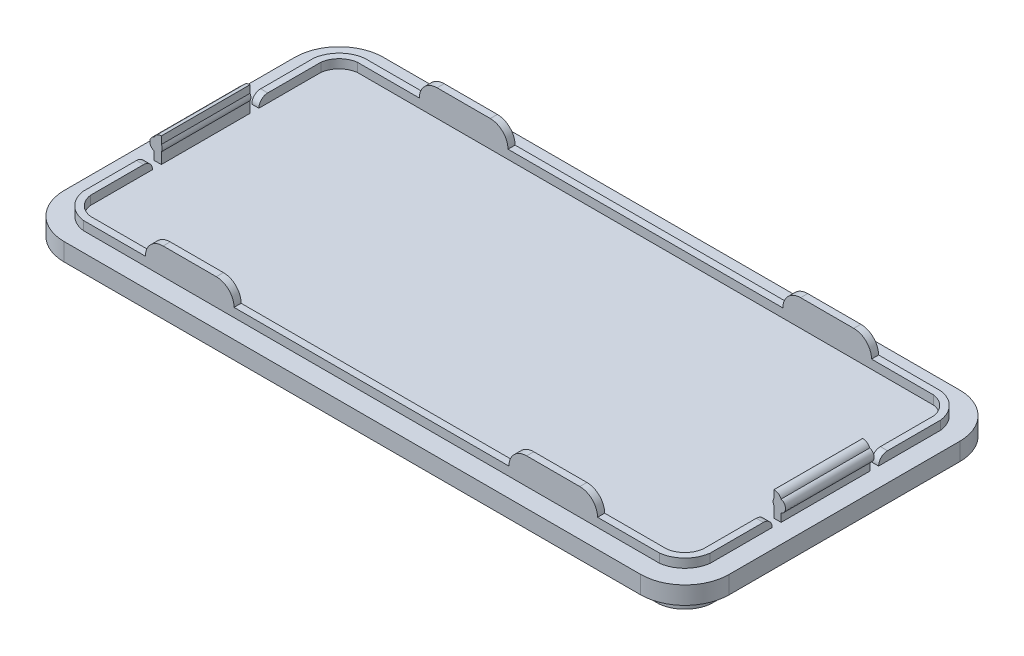
from build123d import *

# Parameters (mm, degrees)
EXTRUDE_2_DEPTH     = 2
EXTRUDE_4_DEPTH     = 1
SKETCH_7_W          = 0.8
SKETCH_7_H          = 10
EXTRUDE_8_DEPTH     = 2.8
SKETCH_8_R          = 0.7
EXTRUDE_9_DEPTH     = 10
FILLET_1_R          = 0.85
SKETCH_11_W         = 1
SKETCH_11_H         = 1
CUT_EXTRUDE_1_DEPTH = 1.2
FILLET_2_R          = 1
SKETCH_13_W         = 0.8
SKETCH_13_H         = 10
EXTRUDE_10_DEPTH    = 1.8
SKETCH_14_R         = 0.7
EXTRUDE_11_DEPTH    = 10
FILLET_3_R          = 0.85
SKETCH_15_W         = 0.8
SKETCH_15_H         = 1
CUT_EXTRUDE_3_DEPTH = 1
FILLET_4_R          = 1
EXTRUDE_START       = -2
EXTRUDE_12_DEPTH    = 2
SKETCH_18_R         = 3.225
SKETCH_18_R_2       = 2.225
EXTRUDE_13_DEPTH    = 2
CUT_EXTRUDE_4_DEPTH = 2
EXTRUDE_START_2     = 2
EXTRUDE_14_DEPTH    = 2
SKETCH_22_W         = 10
SKETCH_22_H         = 0.8
EXTRUDE_16_DEPTH    = 2
FILLET_5_R          = 2


# Some blends are built 0.0001 mm under size
with BuildPart() as part:
    # case 2 → 凸台-拉伸2 (new body)
    with BuildSketch(Plane(origin=(0, 0, 0), x_dir=(1, 0, 0), z_dir=(0, 1, 0))):
        with BuildLine():
            Line((-34.042196447, 18), (30.957803553, 18))
            ThreePointArc((30.957803553, 18), (34.493337459, 16.535533906), (35.957803553, 13))
            Line((35.957803553, 13), (35.957803553, -13))
            ThreePointArc((35.957803553, -13), (34.493337459, -16.535533906), (30.957803553, -18))
            Line((30.957803553, -18), (-34.042196447, -18))
            ThreePointArc((-34.042196447, -18), (-37.577730353, -16.535533906), (-39.042196447, -13))
            Line((-39.042196447, -13), (-39.042196447, 13))
            ThreePointArc((-39.042196447, 13), (-37.577730353, 16.535533906), (-34.042196447, 18))
        make_face()
    extrude(amount=EXTRUDE_2_DEPTH)

    # 草图3 → 凸台-拉伸4 (add)
    with BuildSketch(Plane(origin=(0, 2, 0), x_dir=(1, 0, 0), z_dir=(0, 1, 0))):
        with BuildLine():
            Line((-36.892196447, 13), (-36.892196447, -13))
            ThreePointArc((-36.892196447, -13), (-35.952846076, -14.910649629), (-34.042196447, -15.85))
            Line((-34.042196447, -15.85), (30.957803553, -15.85))
            ThreePointArc((30.957803553, -15.85), (32.868453181, -14.910649629), (33.807803553, -13))
            Line((33.807803553, -13), (33.807803553, 13))
            ThreePointArc((33.807803553, 13), (32.868453181, 14.910649629), (30.957803553, 15.85))
            Line((30.957803553, 15.85), (-34.042196447, 15.85))
            ThreePointArc((-34.042196447, 15.85), (-35.952846076, 14.910649629), (-36.892196447, 13))
        make_face()
        with BuildLine():
            Line((-34.042196447, -15.05), (30.957803553, -15.05))
            ThreePointArc((30.957803553, -15.05), (32.327315928, -14.369512375), (33.007803553, -13))
            Line((33.007803553, -13), (33.007803553, 13))
            ThreePointArc((33.007803553, 13), (32.327315928, 14.369512375), (30.957803553, 15.05))
            Line((30.957803553, 15.05), (-34.042196447, 15.05))
            ThreePointArc((-34.042196447, 15.05), (-35.411708823, 14.369512375), (-36.092196447, 13))
            Line((-36.092196447, 13), (-36.092196447, -13))
            ThreePointArc((-36.092196447, -13), (-35.411708823, -14.369512375), (-34.042196447, -15.05))
        make_face(mode=Mode.SUBTRACT)
    extrude(amount=EXTRUDE_4_DEPTH)

    # 草图7 → 凸台-拉伸8 (add)
    with BuildSketch(Plane(origin=(0, 2, 0), x_dir=(1, 0, 0), z_dir=(0, 1, 0))):
        with Locations((-36.492196447, 0)):
            Rectangle(SKETCH_7_W, SKETCH_7_H)
    extrude(amount=EXTRUDE_8_DEPTH)

    # 草图8 → 凸台-拉伸9 (add)
    with BuildSketch(Plane.XY.offset(5)):
        with Locations((-36.692196447, 3.6)):
            Circle(SKETCH_8_R)
    extrude(amount=-EXTRUDE_9_DEPTH)

    # 圆角1
    # the kernel refuses this fillet: 0.85 mm, written as the material it takes off along each edge
    with BuildSketch(Plane(origin=(-36.892196447, 4.8, 6.967826014), x_dir=(0, -1, 0), z_dir=(0, 0, -1))) as fillet_1_piece_1:
        with BuildLine():
            CenterArc((0.85, -0.787130406), FILLET_1_R, 112.174937704, 67.825062296)
            Line((0, -0.787130406), (-0.017, -0.787130406))
            Line((-0.017, -0.787130406), (-0.017, 0))
            Line((-0.017, 0), (0, 0.017))
            ThreePointArc((0, 0.017), (0.264589803, 0.017), (0.522763199, 0.015742608))
            Line((0.522763199, 0.015742608), (0.529179607, 0))
        make_face()
    extrude(amount=13.935652028, mode=Mode.SUBTRACT)

    # 草图11 → 切除-拉伸1 (cut)
    with BuildSketch(Plane.ZY.offset(36.892196447)):
        with Locations((5.5, 2.5)):
            Rectangle(SKETCH_11_W, SKETCH_11_H)
        with Locations((-5.5, 2.5)):
            Rectangle(SKETCH_11_W, SKETCH_11_H)
    extrude(amount=-CUT_EXTRUDE_1_DEPTH, mode=Mode.SUBTRACT)

    # 圆角2
    fillet_2_edges = [part.edges().sort_by_distance(p)[0] for p in [
        (-36.492196447, 3, 6),
        (-36.492196447, 3, -6),
    ]]
    fillet(fillet_2_edges, radius=FILLET_2_R - 0.0001)  # a hair under: the kernel refuses the full size

    # 草图13 → 凸台-拉伸10 (add)
    with BuildSketch(Plane(origin=(0, 3, 0), x_dir=(1, 0, 0), z_dir=(0, 1, 0))):
        with Locations((33.407803553, 0)):
            Rectangle(SKETCH_13_W, SKETCH_13_H)
    extrude(amount=EXTRUDE_10_DEPTH)

    # 草图14 → 凸台-拉伸11 (add)
    with BuildSketch(Plane.XY.offset(5)):
        with Locations((33.607803553, 3.6)):
            Circle(SKETCH_14_R)
    extrude(amount=-EXTRUDE_11_DEPTH)

    # 圆角3
    # the kernel refuses this fillet: 0.85 mm, written as the material it takes off along each edge
    with BuildSketch(Plane(origin=(33.807803553, 4.8, -6.967826014), x_dir=(0, -1, 0), z_dir=(0, 0, 1))) as fillet_3_piece_1:
        with BuildLine():
            CenterArc((0.85, -0.787130406), FILLET_3_R, 112.174937704, 67.825062296)
            Line((0, -0.787130406), (-0.017, -0.787130406))
            Line((-0.017, -0.787130406), (-0.017, 0))
            Line((-0.017, 0), (0, 0.017))
            ThreePointArc((0, 0.017), (0.264589803, 0.017), (0.522763199, 0.015742608))
            Line((0.522763199, 0.015742608), (0.529179607, 0))
        make_face()
    extrude(amount=13.935652028, mode=Mode.SUBTRACT)

    # 草图15 → 切除-拉伸3 (cut)
    with BuildSketch(Plane(origin=(0, 3, 0), x_dir=(1, 0, 0), z_dir=(0, 1, 0))):
        with Locations((33.407803553, 5.5)):
            Rectangle(SKETCH_15_W, SKETCH_15_H)
        with Locations((33.407803553, -5.5)):
            Rectangle(SKETCH_15_W, SKETCH_15_H)
    extrude(amount=-CUT_EXTRUDE_3_DEPTH, mode=Mode.SUBTRACT)

    # 圆角4
    fillet_4_edges = [part.edges().sort_by_distance(p)[0] for p in [
        (33.407803553, 3, 6),
        (33.407803553, 3, -6),
    ]]
    fillet(fillet_4_edges, radius=FILLET_4_R - 0.0001)  # a hair under: the kernel refuses the full size

    # 草图2 → 凸台-拉伸12 (add)
    with BuildSketch(Plane(origin=(0, 0, 0), x_dir=(1, 0, 0), z_dir=(0, 1, 0)).offset(EXTRUDE_START)):
        with BuildLine():
            Line((33.807803553, -13), (33.807803553, 13))
            ThreePointArc((33.807803553, 13), (32.868453181, 14.910649629), (30.957803553, 15.85))
            Line((30.957803553, 15.85), (-34.042196447, 15.85))
            ThreePointArc((-34.042196447, 15.85), (-35.952846076, 14.910649629), (-36.892196447, 13))
            Line((-36.892196447, 13), (-36.892196447, -13))
            ThreePointArc((-36.892196447, -13), (-35.952846076, -14.910649629), (-34.042196447, -15.85))
            Line((-34.042196447, -15.85), (30.957803553, -15.85))
            ThreePointArc((30.957803553, -15.85), (32.868453181, -14.910649629), (33.807803553, -13))
        make_face()
        with BuildLine():
            Line((-34.042196447, -15.05), (30.957803553, -15.05))
            ThreePointArc((30.957803553, -15.05), (32.327315928, -14.369512375), (33.007803553, -13))
            Line((33.007803553, -13), (33.007803553, 13))
            ThreePointArc((33.007803553, 13), (32.327315928, 14.369512375), (30.957803553, 15.05))
            Line((30.957803553, 15.05), (-34.042196447, 15.05))
            ThreePointArc((-34.042196447, 15.05), (-35.411708823, 14.369512375), (-36.092196447, 13))
            Line((-36.092196447, 13), (-36.092196447, -13))
            ThreePointArc((-36.092196447, -13), (-35.411708823, -14.369512375), (-34.042196447, -15.05))
        make_face(mode=Mode.SUBTRACT)
    extrude(amount=EXTRUDE_12_DEPTH)

    # 草图18 → 凸台-拉伸13 (add)
    # profile 1 of 50: a face of its own
    with BuildSketch(Plane.XZ):
        with Locations((-37.317196447, 15.9)):
            Circle(SKETCH_18_R)
        with Locations((-37.317196447, 15.9)):
            Circle(SKETCH_18_R_2, mode=Mode.SUBTRACT)
    # profile 2 of 50: a face of its own
    with BuildSketch(Plane.XZ):
        with Locations((-29.367196447, 15.9)):
            Circle(SKETCH_18_R)
        with Locations((-29.367196447, 15.9)):
            Circle(SKETCH_18_R_2, mode=Mode.SUBTRACT)
    # profile 3 of 50: a face of its own
    with BuildSketch(Plane.XZ):
        with Locations((-21.417196447, 15.9)):
            Circle(SKETCH_18_R)
        with Locations((-21.417196447, 15.9)):
            Circle(SKETCH_18_R_2, mode=Mode.SUBTRACT)
    # profile 4 of 50: a face of its own
    with BuildSketch(Plane.XZ):
        with Locations((-13.467196447, 15.9)):
            Circle(SKETCH_18_R)
        with Locations((-13.467196447, 15.9)):
            Circle(SKETCH_18_R_2, mode=Mode.SUBTRACT)
    # profile 5 of 50: a face of its own
    with BuildSketch(Plane.XZ):
        with Locations((-5.517196447, 15.9)):
            Circle(SKETCH_18_R)
        with Locations((-5.517196447, 15.9)):
            Circle(SKETCH_18_R_2, mode=Mode.SUBTRACT)
    # profile 6 of 50: a face of its own
    with BuildSketch(Plane.XZ):
        with Locations((2.432803553, 15.9)):
            Circle(SKETCH_18_R)
        with Locations((2.432803553, 15.9)):
            Circle(SKETCH_18_R_2, mode=Mode.SUBTRACT)
    # profile 7 of 50: a face of its own
    with BuildSketch(Plane.XZ):
        with Locations((10.382803553, 15.9)):
            Circle(SKETCH_18_R)
        with Locations((10.382803553, 15.9)):
            Circle(SKETCH_18_R_2, mode=Mode.SUBTRACT)
    # profile 8 of 50: a face of its own
    with BuildSketch(Plane.XZ):
        with Locations((18.332803553, 15.9)):
            Circle(SKETCH_18_R)
        with Locations((18.332803553, 15.9)):
            Circle(SKETCH_18_R_2, mode=Mode.SUBTRACT)
    # profile 9 of 50: a face of its own
    with BuildSketch(Plane.XZ):
        with Locations((26.282803553, 15.9)):
            Circle(SKETCH_18_R)
        with Locations((26.282803553, 15.9)):
            Circle(SKETCH_18_R_2, mode=Mode.SUBTRACT)
    # profile 10 of 50: a face of its own
    with BuildSketch(Plane.XZ):
        with Locations((34.232803553, 15.9)):
            Circle(SKETCH_18_R)
        with Locations((34.232803553, 15.9)):
            Circle(SKETCH_18_R_2, mode=Mode.SUBTRACT)
    # profile 11 of 50: a face of its own
    with BuildSketch(Plane.XZ):
        with Locations(Location((-29.367196447, 7.95, 0), (0, 0, 90))):
            Circle(SKETCH_18_R)
        with Locations(Location((-29.367196447, 7.95, 0), (0, 0, 270))):
            Circle(SKETCH_18_R_2, mode=Mode.SUBTRACT)
    # profile 12 of 50: a face of its own
    with BuildSketch(Plane.XZ):
        with Locations(Location((-21.417196447, 7.95, 0), (0, 0, 90))):
            Circle(SKETCH_18_R)
        with Locations(Location((-21.417196447, 7.95, 0), (0, 0, 270))):
            Circle(SKETCH_18_R_2, mode=Mode.SUBTRACT)
    # profile 13 of 50: a face of its own
    with BuildSketch(Plane.XZ):
        with Locations(Location((-13.467196447, 7.95, 0), (0, 0, 90))):
            Circle(SKETCH_18_R)
        with Locations(Location((-13.467196447, 7.95, 0), (0, 0, 270))):
            Circle(SKETCH_18_R_2, mode=Mode.SUBTRACT)
    # profile 14 of 50: a face of its own
    with BuildSketch(Plane.XZ):
        with Locations(Location((-5.517196447, 7.95, 0), (0, 0, 90))):
            Circle(SKETCH_18_R)
        with Locations(Location((-5.517196447, 7.95, 0), (0, 0, 270))):
            Circle(SKETCH_18_R_2, mode=Mode.SUBTRACT)
    # profile 15 of 50: a face of its own
    with BuildSketch(Plane.XZ):
        with Locations(Location((2.432803553, 7.95, 0), (0, 0, 90))):
            Circle(SKETCH_18_R)
        with Locations(Location((2.432803553, 7.95, 0), (0, 0, 270))):
            Circle(SKETCH_18_R_2, mode=Mode.SUBTRACT)
    # profile 16 of 50: a face of its own
    with BuildSketch(Plane.XZ):
        with Locations(Location((10.382803553, 7.95, 0), (0, 0, 90))):
            Circle(SKETCH_18_R)
        with Locations(Location((10.382803553, 7.95, 0), (0, 0, 270))):
            Circle(SKETCH_18_R_2, mode=Mode.SUBTRACT)
    # profile 17 of 50: a face of its own
    with BuildSketch(Plane.XZ):
        with Locations(Location((18.332803553, 7.95, 0), (0, 0, 90))):
            Circle(SKETCH_18_R)
        with Locations(Location((18.332803553, 7.95, 0), (0, 0, 270))):
            Circle(SKETCH_18_R_2, mode=Mode.SUBTRACT)
    # profile 18 of 50: a face of its own
    with BuildSketch(Plane.XZ):
        with Locations(Location((26.282803553, 7.95, 0), (0, 0, 90))):
            Circle(SKETCH_18_R)
        with Locations(Location((26.282803553, 7.95, 0), (0, 0, 270))):
            Circle(SKETCH_18_R_2, mode=Mode.SUBTRACT)
    # profile 19 of 50: a face of its own
    with BuildSketch(Plane.XZ):
        with Locations((34.232803553, 7.95)):
            Circle(SKETCH_18_R)
        with Locations((34.232803553, 7.95)):
            Circle(SKETCH_18_R_2, mode=Mode.SUBTRACT)
    # profile 20 of 50: a face of its own
    with BuildSketch(Plane.XZ):
        with Locations(Location((-29.367196447, 0, 0), (0, 0, 90))):
            Circle(SKETCH_18_R)
        with Locations(Location((-29.367196447, 0, 0), (0, 0, 270))):
            Circle(SKETCH_18_R_2, mode=Mode.SUBTRACT)
    # profile 21 of 50: a face of its own
    with BuildSketch(Plane.XZ):
        with Locations(Location((-21.417196447, 0, 0), (0, 0, 90))):
            Circle(SKETCH_18_R)
        with Locations(Location((-21.417196447, 0, 0), (0, 0, 270))):
            Circle(SKETCH_18_R_2, mode=Mode.SUBTRACT)
    # profile 22 of 50: a face of its own
    with BuildSketch(Plane.XZ):
        with Locations(Location((-13.467196447, 0, 0), (0, 0, 90))):
            Circle(SKETCH_18_R)
        with Locations(Location((-13.467196447, 0, 0), (0, 0, 270))):
            Circle(SKETCH_18_R_2, mode=Mode.SUBTRACT)
    # profile 23 of 50: a face of its own
    with BuildSketch(Plane.XZ):
        with Locations(Location((-5.517196447, 0, 0), (0, 0, 90))):
            Circle(SKETCH_18_R)
        with Locations(Location((-5.517196447, 0, 0), (0, 0, 270))):
            Circle(SKETCH_18_R_2, mode=Mode.SUBTRACT)
    # profile 24 of 50: a face of its own
    with BuildSketch(Plane.XZ):
        with Locations(Location((2.432803553, 0, 0), (0, 0, 90))):
            Circle(SKETCH_18_R)
        with Locations(Location((2.432803553, 0, 0), (0, 0, 270))):
            Circle(SKETCH_18_R_2, mode=Mode.SUBTRACT)
    # profile 25 of 50: a face of its own
    with BuildSketch(Plane.XZ):
        with Locations(Location((10.382803553, 0, 0), (0, 0, 90))):
            Circle(SKETCH_18_R)
        with Locations(Location((10.382803553, 0, 0), (0, 0, 270))):
            Circle(SKETCH_18_R_2, mode=Mode.SUBTRACT)
    # profile 26 of 50: a face of its own
    with BuildSketch(Plane.XZ):
        with Locations(Location((18.332803553, 0, 0), (0, 0, 90))):
            Circle(SKETCH_18_R)
        with Locations(Location((18.332803553, 0, 0), (0, 0, 270))):
            Circle(SKETCH_18_R_2, mode=Mode.SUBTRACT)
    # profile 27 of 50: a face of its own
    with BuildSketch(Plane.XZ):
        with Locations(Location((26.282803553, 0, 0), (0, 0, 90))):
            Circle(SKETCH_18_R)
        with Locations(Location((26.282803553, 0, 0), (0, 0, 270))):
            Circle(SKETCH_18_R_2, mode=Mode.SUBTRACT)
    # profile 28 of 50: a face of its own
    with BuildSketch(Plane.XZ):
        with Locations((34.232803553, 0)):
            Circle(SKETCH_18_R)
        with Locations((34.232803553, 0)):
            Circle(SKETCH_18_R_2, mode=Mode.SUBTRACT)
    # profile 29 of 50: a face of its own
    with BuildSketch(Plane.XZ):
        with Locations(Location((-29.367196447, -7.95, 0), (0, 0, 90))):
            Circle(SKETCH_18_R)
        with Locations(Location((-29.367196447, -7.95, 0), (0, 0, 270))):
            Circle(SKETCH_18_R_2, mode=Mode.SUBTRACT)
    # profile 30 of 50: a face of its own
    with BuildSketch(Plane.XZ):
        with Locations(Location((-21.417196447, -7.95, 0), (0, 0, 90))):
            Circle(SKETCH_18_R)
        with Locations(Location((-21.417196447, -7.95, 0), (0, 0, 270))):
            Circle(SKETCH_18_R_2, mode=Mode.SUBTRACT)
    # profile 31 of 50: a face of its own
    with BuildSketch(Plane.XZ):
        with Locations(Location((-13.467196447, -7.95, 0), (0, 0, 90))):
            Circle(SKETCH_18_R)
        with Locations(Location((-13.467196447, -7.95, 0), (0, 0, 270))):
            Circle(SKETCH_18_R_2, mode=Mode.SUBTRACT)
    # profile 32 of 50: a face of its own
    with BuildSketch(Plane.XZ):
        with Locations(Location((-5.517196447, -7.95, 0), (0, 0, 90))):
            Circle(SKETCH_18_R)
        with Locations(Location((-5.517196447, -7.95, 0), (0, 0, 270))):
            Circle(SKETCH_18_R_2, mode=Mode.SUBTRACT)
    # profile 33 of 50: a face of its own
    with BuildSketch(Plane.XZ):
        with Locations(Location((2.432803553, -7.95, 0), (0, 0, 90))):
            Circle(SKETCH_18_R)
        with Locations(Location((2.432803553, -7.95, 0), (0, 0, 270))):
            Circle(SKETCH_18_R_2, mode=Mode.SUBTRACT)
    # profile 34 of 50: a face of its own
    with BuildSketch(Plane.XZ):
        with Locations(Location((10.382803553, -7.95, 0), (0, 0, 90))):
            Circle(SKETCH_18_R)
        with Locations(Location((10.382803553, -7.95, 0), (0, 0, 270))):
            Circle(SKETCH_18_R_2, mode=Mode.SUBTRACT)
    # profile 35 of 50: a face of its own
    with BuildSketch(Plane.XZ):
        with Locations(Location((18.332803553, -7.95, 0), (0, 0, 90))):
            Circle(SKETCH_18_R)
        with Locations(Location((18.332803553, -7.95, 0), (0, 0, 270))):
            Circle(SKETCH_18_R_2, mode=Mode.SUBTRACT)
    # profile 36 of 50: a face of its own
    with BuildSketch(Plane.XZ):
        with Locations(Location((26.282803553, -7.95, 0), (0, 0, 90))):
            Circle(SKETCH_18_R)
        with Locations(Location((26.282803553, -7.95, 0), (0, 0, 270))):
            Circle(SKETCH_18_R_2, mode=Mode.SUBTRACT)
    # profile 37 of 50: a face of its own
    with BuildSketch(Plane.XZ):
        with Locations((34.232803553, -7.95)):
            Circle(SKETCH_18_R)
        with Locations((34.232803553, -7.95)):
            Circle(SKETCH_18_R_2, mode=Mode.SUBTRACT)
    # profile 38 of 50: a face of its own
    with BuildSketch(Plane.XZ):
        with Locations((-29.367196447, -15.9)):
            Circle(SKETCH_18_R)
        with Locations((-29.367196447, -15.9)):
            Circle(SKETCH_18_R_2, mode=Mode.SUBTRACT)
    # profile 39 of 50: a face of its own
    with BuildSketch(Plane.XZ):
        with Locations((-21.417196447, -15.9)):
            Circle(SKETCH_18_R)
        with Locations((-21.417196447, -15.9)):
            Circle(SKETCH_18_R_2, mode=Mode.SUBTRACT)
    # profile 40 of 50: a face of its own
    with BuildSketch(Plane.XZ):
        with Locations((-13.467196447, -15.9)):
            Circle(SKETCH_18_R)
        with Locations((-13.467196447, -15.9)):
            Circle(SKETCH_18_R_2, mode=Mode.SUBTRACT)
    # profile 41 of 50: a face of its own
    with BuildSketch(Plane.XZ):
        with Locations((-5.517196447, -15.9)):
            Circle(SKETCH_18_R)
        with Locations((-5.517196447, -15.9)):
            Circle(SKETCH_18_R_2, mode=Mode.SUBTRACT)
    # profile 42 of 50: a face of its own
    with BuildSketch(Plane.XZ):
        with Locations((2.432803553, -15.9)):
            Circle(SKETCH_18_R)
        with Locations((2.432803553, -15.9)):
            Circle(SKETCH_18_R_2, mode=Mode.SUBTRACT)
    # profile 43 of 50: a face of its own
    with BuildSketch(Plane.XZ):
        with Locations((10.382803553, -15.9)):
            Circle(SKETCH_18_R)
        with Locations((10.382803553, -15.9)):
            Circle(SKETCH_18_R_2, mode=Mode.SUBTRACT)
    # profile 44 of 50: a face of its own
    with BuildSketch(Plane.XZ):
        with Locations((18.332803553, -15.9)):
            Circle(SKETCH_18_R)
        with Locations((18.332803553, -15.9)):
            Circle(SKETCH_18_R_2, mode=Mode.SUBTRACT)
    # profile 45 of 50: a face of its own
    with BuildSketch(Plane.XZ):
        with Locations((26.282803553, -15.9)):
            Circle(SKETCH_18_R)
        with Locations((26.282803553, -15.9)):
            Circle(SKETCH_18_R_2, mode=Mode.SUBTRACT)
    # profile 46 of 50: a face of its own
    with BuildSketch(Plane.XZ):
        with Locations((34.232803553, -15.9)):
            Circle(SKETCH_18_R)
        with Locations((34.232803553, -15.9)):
            Circle(SKETCH_18_R_2, mode=Mode.SUBTRACT)
    # profile 47 of 50: a face of its own
    with BuildSketch(Plane.XZ):
        with Locations((-37.317196447, 7.95)):
            Circle(SKETCH_18_R)
        with Locations((-37.317196447, 7.95)):
            Circle(SKETCH_18_R_2, mode=Mode.SUBTRACT)
    # profile 48 of 50: a face of its own
    with BuildSketch(Plane.XZ):
        with Locations((-37.317196447, 0)):
            Circle(SKETCH_18_R)
        with Locations((-37.317196447, 0)):
            Circle(SKETCH_18_R_2, mode=Mode.SUBTRACT)
    # profile 49 of 50: a face of its own
    with BuildSketch(Plane.XZ):
        with Locations((-37.317196447, -7.95)):
            Circle(SKETCH_18_R)
        with Locations((-37.317196447, -7.95)):
            Circle(SKETCH_18_R_2, mode=Mode.SUBTRACT)
    # profile 50 of 50: a face of its own
    with BuildSketch(Plane.XZ):
        with Locations((-37.317196447, -15.9)):
            Circle(SKETCH_18_R)
        with Locations((-37.317196447, -15.9)):
            Circle(SKETCH_18_R_2, mode=Mode.SUBTRACT)
    extrude(amount=EXTRUDE_13_DEPTH)

    # 草图20 → 切除-拉伸4 (cut)
    with BuildSketch(Plane.XZ):
        with BuildLine():
            Line((-36.892196447, -11.146873473), (-36.892196447, -12.703126527))
            ThreePointArc((-36.892196447, -12.703126527), (-39.724380134, -18.046180723), (-34.092698816, -15.843078796))
            ThreePointArc((-34.092698816, -15.843078796), (-34.067460995, -15.846636912), (-34.042196447, -15.85))
            Line((-34.042196447, -15.85), (-32.591808827, -15.85))
            ThreePointArc((-32.591808827, -15.85), (-29.367196447, -19.125), (-26.142584067, -15.85))
            Line((-26.142584067, -15.85), (-24.641808827, -15.85))
            ThreePointArc((-24.641808827, -15.85), (-21.417196447, -19.125), (-18.192584067, -15.85))
            Line((-18.192584067, -15.85), (-16.691808827, -15.85))
            ThreePointArc((-16.691808827, -15.85), (-13.467196447, -19.125), (-10.242584067, -15.85))
            Line((-10.242584067, -15.85), (-8.741808827, -15.85))
            ThreePointArc((-8.741808827, -15.85), (-5.517196447, -19.125), (-2.292584067, -15.85))
            Line((-2.292584067, -15.85), (-0.791808827, -15.85))
            ThreePointArc((-0.791808827, -15.85), (2.432803553, -19.125), (5.657415933, -15.85))
            Line((5.657415933, -15.85), (7.158191173, -15.85))
            ThreePointArc((7.158191173, -15.85), (10.382803553, -19.125), (13.607415933, -15.85))
            Line((13.607415933, -15.85), (15.108191173, -15.85))
            ThreePointArc((15.108191173, -15.85), (18.332803553, -19.125), (21.557415933, -15.85))
            Line((21.557415933, -15.85), (23.058191173, -15.85))
            ThreePointArc((23.058191173, -15.85), (26.282803553, -19.125), (29.507415933, -15.85))
            Line((29.507415933, -15.85), (30.957803553, -15.85))
            ThreePointArc((30.957803553, -15.85), (30.983068101, -15.846636912), (31.008305921, -15.843078796))
            ThreePointArc((31.008305921, -15.843078796), (36.63998724, -18.046180723), (33.807803553, -12.703126527))
            Line((33.807803553, -12.703126527), (33.807803553, -11.146873473))
            ThreePointArc((33.807803553, -11.146873473), (37.457803553, -7.95), (33.807803553, -4.753126527))
            Line((33.807803553, -4.753126527), (33.807803553, -3.196873473))
            ThreePointArc((33.807803553, -3.196873473), (37.457803553, 0), (33.807803553, 3.196873473))
            Line((33.807803553, 3.196873473), (33.807803553, 4.753126527))
            ThreePointArc((33.807803553, 4.753126527), (37.457803553, 7.95), (33.807803553, 11.146873473))
            Line((33.807803553, 11.146873473), (33.807803553, 12.703126527))
            ThreePointArc((33.807803553, 12.703126527), (36.63998724, 18.046180723), (31.008305921, 15.843078796))
            ThreePointArc((31.008305921, 15.843078796), (30.983068101, 15.846636912), (30.957803553, 15.85))
            Line((30.957803553, 15.85), (29.507415933, 15.85))
            ThreePointArc((29.507415933, 15.85), (26.282803553, 19.125), (23.058191173, 15.85))
            Line((23.058191173, 15.85), (21.557415933, 15.85))
            ThreePointArc((21.557415933, 15.85), (18.332803553, 19.125), (15.108191173, 15.85))
            Line((15.108191173, 15.85), (13.607415933, 15.85))
            ThreePointArc((13.607415933, 15.85), (10.382803553, 19.125), (7.158191173, 15.85))
            Line((7.158191173, 15.85), (5.657415933, 15.85))
            ThreePointArc((5.657415933, 15.85), (2.432803553, 19.125), (-0.791808827, 15.85))
            Line((-0.791808827, 15.85), (-2.292584067, 15.85))
            ThreePointArc((-2.292584067, 15.85), (-5.517196447, 19.125), (-8.741808827, 15.85))
            Line((-8.741808827, 15.85), (-10.242584067, 15.85))
            ThreePointArc((-10.242584067, 15.85), (-13.467196447, 19.125), (-16.691808827, 15.85))
            Line((-16.691808827, 15.85), (-18.192584067, 15.85))
            ThreePointArc((-18.192584067, 15.85), (-21.417196447, 19.125), (-24.641808827, 15.85))
            Line((-24.641808827, 15.85), (-26.142584067, 15.85))
            ThreePointArc((-26.142584067, 15.85), (-29.367196447, 19.125), (-32.591808827, 15.85))
            Line((-32.591808827, 15.85), (-34.042196447, 15.85))
            ThreePointArc((-34.042196447, 15.85), (-34.067460995, 15.846636912), (-34.092698816, 15.843078796))
            ThreePointArc((-34.092698816, 15.843078796), (-39.724380134, 18.046180723), (-36.892196447, 12.703126527))
            Line((-36.892196447, 12.703126527), (-36.892196447, 11.146873473))
            ThreePointArc((-36.892196447, 11.146873473), (-40.542196447, 7.95), (-36.892196447, 4.753126527))
            Line((-36.892196447, 4.753126527), (-36.892196447, 3.196873473))
            ThreePointArc((-36.892196447, 3.196873473), (-40.542196447, 0), (-36.892196447, -3.196873473))
            Line((-36.892196447, -3.196873473), (-36.892196447, -4.753126527))
            ThreePointArc((-36.892196447, -4.753126527), (-40.542196447, -7.95), (-36.892196447, -11.146873473))
        make_face()
        with BuildLine():
            Line((-36.092196447, 13), (-36.092196447, -13))
            ThreePointArc((-36.092196447, -13), (-35.411708823, -14.369512375), (-34.042196447, -15.05))
            Line((-34.042196447, -15.05), (30.957803553, -15.05))
            ThreePointArc((30.957803553, -15.05), (32.327315928, -14.369512375), (33.007803553, -13))
            Line((33.007803553, -13), (33.007803553, 13))
            ThreePointArc((33.007803553, 13), (32.327315928, 14.369512375), (30.957803553, 15.05))
            Line((30.957803553, 15.05), (-34.042196447, 15.05))
            ThreePointArc((-34.042196447, 15.05), (-35.411708823, 14.369512375), (-36.092196447, 13))
        make_face(mode=Mode.SUBTRACT)
    extrude(amount=CUT_EXTRUDE_4_DEPTH, mode=Mode.SUBTRACT)

    # 草图21 → 凸台-拉伸14 (add)
    with BuildSketch(Plane.XZ.offset(EXTRUDE_START_2)):
        with BuildLine():
            Line((-36.892196447, 13), (-36.892196447, -13))
            ThreePointArc((-36.892196447, -13), (-35.952846076, -14.910649629), (-34.042196447, -15.85))
            Line((-34.042196447, -15.85), (30.957803553, -15.85))
            ThreePointArc((30.957803553, -15.85), (32.868453181, -14.910649629), (33.807803553, -13))
            Line((33.807803553, -13), (33.807803553, 13))
            ThreePointArc((33.807803553, 13), (32.868453181, 14.910649629), (30.957803553, 15.85))
            Line((30.957803553, 15.85), (-34.042196447, 15.85))
            ThreePointArc((-34.042196447, 15.85), (-35.952846076, 14.910649629), (-36.892196447, 13))
        make_face()
        with BuildLine():
            Line((30.957803553, 15.05), (-34.042196447, 15.05))
            ThreePointArc((-34.042196447, 15.05), (-35.411708823, 14.369512375), (-36.092196447, 13))
            Line((-36.092196447, 13), (-36.092196447, -13))
            ThreePointArc((-36.092196447, -13), (-35.411708823, -14.369512375), (-34.042196447, -15.05))
            Line((-34.042196447, -15.05), (30.957803553, -15.05))
            ThreePointArc((30.957803553, -15.05), (32.327315928, -14.369512375), (33.007803553, -13))
            Line((33.007803553, -13), (33.007803553, 13))
            ThreePointArc((33.007803553, 13), (32.327315928, 14.369512375), (30.957803553, 15.05))
        make_face(mode=Mode.SUBTRACT)
    extrude(amount=-EXTRUDE_14_DEPTH)

    # 草图22 → 凸台-拉伸16 (add)
    with BuildSketch(Plane(origin=(0, 3, 0), x_dir=(1, 0, 0), z_dir=(0, 1, 0))):
        with Locations((-22.042196447, 15.45)):
            Rectangle(SKETCH_22_W, SKETCH_22_H)
        with Locations((18.957803553, 15.45)):
            Rectangle(SKETCH_22_W, SKETCH_22_H)
        with Locations((-22.042196447, -15.45)):
            Rectangle(SKETCH_22_W, SKETCH_22_H)
        with Locations((18.957803553, -15.45)):
            Rectangle(SKETCH_22_W, SKETCH_22_H)
    extrude(amount=EXTRUDE_16_DEPTH)

    # 圆角5
    fillet_5_edges = [part.edges().sort_by_distance(p)[0] for p in [
        (-27.042196447, 5, 15.45),
        (-17.042196447, 5, 15.45),
        (23.957803553, 5, 15.45),
        (13.957803553, 5, 15.45),
        (23.957803553, 5, -15.45),
        (13.957803553, 5, -15.45),
        (-17.042196447, 5, -15.45),
        (-27.042196447, 5, -15.45),
    ]]
    fillet(fillet_5_edges, radius=FILLET_5_R - 0.0001)  # a hair under: the kernel refuses the full size


solid = part.part
